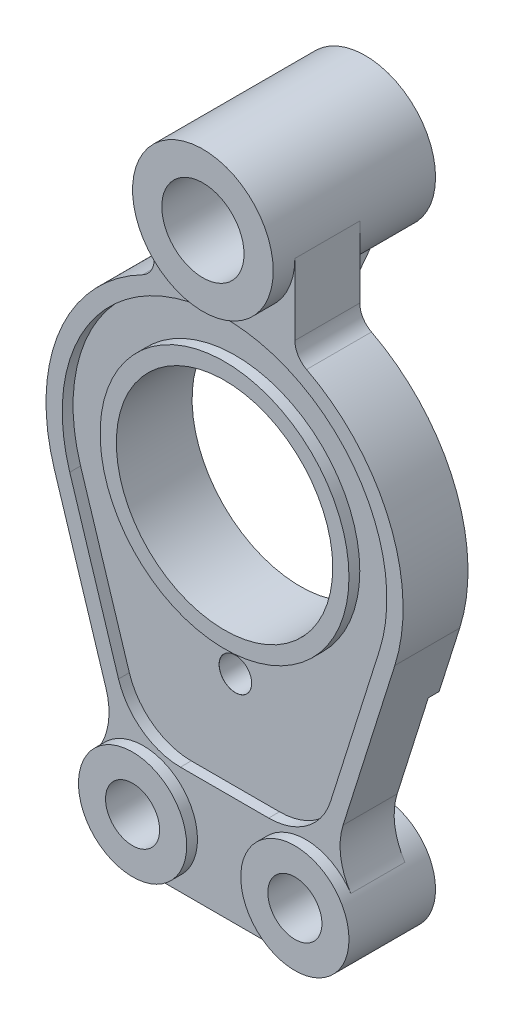
from build123d import *

# Parameters (mm, degrees)
SKETCH1_R               = 50
BOSS_EXTRUDE1_DEPTH     = 35
BOSS_EXTRUDE2_START     = 5
SKETCH1_4_R             = 25
SKETCH1_4_R_2           = 12.5
BOSS_EXTRUDE2_DEPTH     = 40
BOSS_EXTRUDE3_START     = 10
SKETCH1_5_R             = 32.5
BOSS_EXTRUDE3_DEPTH     = 75
SKETCH2_R               = 57.5
CUT_EXTRUDE1_DEPTH      = 5
FILLET1_R               = 10
CUT_EXTRUDE2_START      = -5
CUT_EXTRUDE2_OUTLINE_R  = 57.5
CUT_EXTRUDE2_DEPTH      = 5
CUT_EXTRUDE2_START_2    = -35
CUT_EXTRUDE2_2_DEPTH    = 30
CUT_EXTRUDE3_DEPTH      = 302.76563754
CUT_EXTRUDE3_DEPTH_BACK = 5
RIB1_REACH              = 308.084
SKETCH5_WALL_W          = 655.171326186
SKETCH5_WALL_H          = 20
CUT_EXTRUDE4_DEPTH      = 307.084138759
CUT_EXTRUDE4_DEPTH_BACK = 307.084138759
SKETCH1_6_R             = 12.5
SKETCH1_6_R_2           = 19


# Read off the part's stored shape, not the designer's step: Cut-Extrude2, Ø15.0 (15) Diameter Hole1
with BuildPart() as part:
    # Sketch1 → Boss-Extrude1 (new body)
    with BuildSketch(Plane.XY):
        with BuildLine():
            ThreePointArc((-32.5, 215.828754441), (-74.981933284, 174.408715189), (-78.681648437, 115.191771541))
            Line((-78.681648437, 115.191771541), (-49.309407385, 22.034924488))
            ThreePointArc((-49.309407385, 22.034924488), (-61.74740308, -6.087975353), (-37.5, -25))
            Line((-37.5, -25), (37.5, -25))
            ThreePointArc((37.5, -25), (61.74740308, -6.087975353), (49.309407385, 22.034924488))
            Line((49.309407385, 22.034924488), (78.681648437, 115.191771541))
            ThreePointArc((78.681648437, 115.191771541), (74.981933284, 174.408715189), (32.5, 215.828754441))
            Line((32.5, 215.828754441), (32.5, 255))
            ThreePointArc((32.5, 255), (0, 287.5), (-32.5, 255))
            Line((-32.5, 255), (-32.5, 215.828754441))
        make_face()
        with Locations((0, 140)):
            Circle(SKETCH1_R, mode=Mode.SUBTRACT)
    extrude(amount=-BOSS_EXTRUDE1_DEPTH)

    # Sketch1<4> → Boss-Extrude2 (add)
    # profile 1 of 3: a face of its own
    with BuildSketch(Plane.XY.offset(BOSS_EXTRUDE2_START)):
        with Locations((-37.5, 0)):
            Circle(SKETCH1_4_R)
        with Locations((-37.5, 0)):
            Circle(SKETCH1_4_R_2, mode=Mode.SUBTRACT)
    # profile 2 of 3: a face of its own
    with BuildSketch(Plane.XY.offset(BOSS_EXTRUDE2_START)):
        with Locations((-37.5, 0)):
            Circle(SKETCH1_4_R_2)
    # profile 3 of 3: a face of its own
    with BuildSketch(Plane.XY.offset(BOSS_EXTRUDE2_START)):
        with Locations((37.5, 0)):
            Circle(SKETCH1_4_R)
    extrude(amount=-BOSS_EXTRUDE2_DEPTH)

    # Sketch1<5> → Boss-Extrude3 (add)
    with BuildSketch(Plane.XY.offset(BOSS_EXTRUDE3_START)):
        with Locations((0, 255)):
            Circle(SKETCH1_5_R)
    extrude(amount=-BOSS_EXTRUDE3_DEPTH)

    # Sketch2 → Cut-Extrude1 (cut)
    with BuildSketch(Plane.XY):
        with BuildLine():
            Line((-71.528771306, 117.447065037), (-48.994922099, 45.978826015))
            ThreePointArc((-48.994922099, 45.978826015), (-38.122703028, 30.806661872), (-20.383413577, 25))
            Line((-20.383413577, 25), (20.383413577, 25))
            ThreePointArc((20.383413577, 25), (38.122703028, 30.806661872), (48.994922099, 45.978826015))
            Line((48.994922099, 45.978826015), (71.528771306, 117.447065037))
            ThreePointArc((71.528771306, 117.447065037), (0, 215), (-71.528771306, 117.447065037))
        make_face()
        with Locations((0, 140)):
            Circle(SKETCH2_R, mode=Mode.SUBTRACT)
    extrude(amount=-CUT_EXTRUDE1_DEPTH, mode=Mode.SUBTRACT)

    # Fillet1
    fillet1_edges = [part.edges().sort_by_distance(p)[0] for p in [
        (-32.5, 215.828754441, -17.5),
        (32.5, 215.828754441, -17.5),
    ]]
    fillet(fillet1_edges, radius=FILLET1_R)

    # Cut-Extrude2 outline → Cut-Extrude2 (cut)
    with BuildSketch(Plane(origin=(0, 0, -35), x_dir=(-1, 0, 0), z_dir=(0, 0, -1)).offset(CUT_EXTRUDE2_START)):
        with BuildLine():
            Line((-78.681648437, 115.191771541), (-49.309407385, 22.034924488))
            ThreePointArc((-49.309407385, 22.034924488), (-13.25259692, 6.087975353), (-37.5, -25))
            Line((-37.5, -25), (37.5, -25))
            ThreePointArc((37.5, -25), (13.25259692, 6.087975353), (49.309407385, 22.034924488))
            Line((49.309407385, 22.034924488), (78.681648437, 115.191771541))
            ThreePointArc((78.681648437, 115.191771541), (76.179286423, 171.669643512), (37.905405405, 213.276396207))
            ThreePointArc((37.905405405, 213.276396207), (33.957578038, 216.959631177), (32.5, 222.158383626))
            Line((32.5, 222.158383626), (32.5, 255))
            ThreePointArc((32.5, 255), (0, 222.5), (-32.5, 255))
            Line((-32.5, 255), (-32.5, 222.158383626))
            ThreePointArc((-32.5, 222.158383626), (-33.957578038, 216.959631177), (-37.905405405, 213.276396207))
            ThreePointArc((-37.905405405, 213.276396207), (-76.179286423, 171.669643512), (-78.681648437, 115.191771541))
        make_face()
        with Locations((0, 140)):
            Circle(CUT_EXTRUDE2_OUTLINE_R, mode=Mode.SUBTRACT)
    extrude(amount=CUT_EXTRUDE2_DEPTH, mode=Mode.SUBTRACT)

    # Cut-Extrude2 2 outline → Cut-Extrude2 2 (add)
    with BuildSketch(Plane(origin=(0, 0, -35), x_dir=(-1, 0, 0), z_dir=(0, 0, -1)).offset(CUT_EXTRUDE2_START_2)):
        with BuildLine():
            Line((-49.309407385, 22.034924488), (-54.769381812, 39.351751001))
            ThreePointArc((-54.769381812, 39.351751001), (-53.67166818, 26.163789409), (-58.354950152, 13.786625916))
            ThreePointArc((-58.354950152, 13.786625916), (-54.34484107, 18.472989182), (-49.309407385, 22.034924488))
        make_face()
        with BuildLine():
            Line((54.769381812, 39.351751001), (49.309407385, 22.034924488))
            ThreePointArc((49.309407385, 22.034924488), (54.34484107, 18.472989182), (58.354950152, 13.786625916))
            ThreePointArc((58.354950152, 13.786625916), (53.67166818, 26.163789409), (54.769381812, 39.351751001))
        make_face()
    extrude(amount=CUT_EXTRUDE2_2_DEPTH)

    # Sketch4 → Cut-Extrude3 (cut, two sides: drawn at the far end of the back side and taken through both)
    with BuildSketch(Plane(origin=(0, 0, -30), x_dir=(-1, 0, 0), z_dir=(0, 0, -1)).offset(-CUT_EXTRUDE3_DEPTH_BACK)):
        with BuildLine():
            Line((-61.491869381, 85), (-69.162219436, 85))
            Line((-69.162219436, 85), (-54.769381812, 39.351751001))
            ThreePointArc((-54.769381812, 39.351751001), (-53.67166818, 26.163789409), (-58.354950152, 13.786625916))
            ThreePointArc((-58.354950152, 13.786625916), (-15.481080318, 11.839221936), (-37.5, -25))
            Line((-37.5, -25), (37.5, -25))
            ThreePointArc((37.5, -25), (15.481080318, 11.839221936), (58.354950152, 13.786625916))
            ThreePointArc((58.354950152, 13.786625916), (53.67166818, 26.163789409), (54.769381812, 39.351751001))
            Line((54.769381812, 39.351751001), (69.162219436, 85))
            Line((69.162219436, 85), (61.491869381, 85))
            ThreePointArc((61.491869381, 85), (0, 57.5), (-61.491869381, 85))
        make_face()
    extrude(amount=CUT_EXTRUDE3_DEPTH + CUT_EXTRUDE3_DEPTH_BACK, mode=Mode.SUBTRACT)

    # Sketch5 wall → Rib1 (add, up to next)
    with BuildSketch(Plane(origin=(0, 206.25, -47.5), x_dir=(0, -0.792623989105, 0.60971076085), z_dir=(0, -0.60971076085, -0.792623989105)), mode=Mode.PRIVATE) as rib1_sk1:
        Rectangle(SKETCH5_WALL_W, SKETCH5_WALL_H)
    rib1_tool1 = extrude(rib1_sk1.sketch, amount=-RIB1_REACH, mode=Mode.PRIVATE) - part.part
    add(rib1_tool1.solids().sort_by_distance((0, 206.25, -47.5))[0])

    # Sketch1<6> → Cut-Extrude4 (cut, two sides: drawn at the far end of the back side and taken through both)
    with BuildSketch(Plane.XY.offset(-CUT_EXTRUDE4_DEPTH_BACK)):
        with Locations((-37.5, 0)):
            Circle(SKETCH1_6_R)
        with Locations((37.5, 0)):
            Circle(SKETCH1_6_R)
        with Locations((0, 255)):
            Circle(SKETCH1_6_R_2)
    extrude(amount=CUT_EXTRUDE4_DEPTH + CUT_EXTRUDE4_DEPTH_BACK, mode=Mode.SUBTRACT)

    # Ø15.0 (15) Diameter Hole1 outline → Ø15.0 (15) Diameter Hole1 (revolve, cut)
    with BuildSketch(Plane.XZ.offset(-70)):
        Polygon((0, -30), (7.5, -30), (7.5, -5.025), (7.525, -5), (0, -5), align=None)
    revolve(axis=Axis((0, 70, 0), (0, 0, 1)), mode=Mode.SUBTRACT)


solid = part.part
